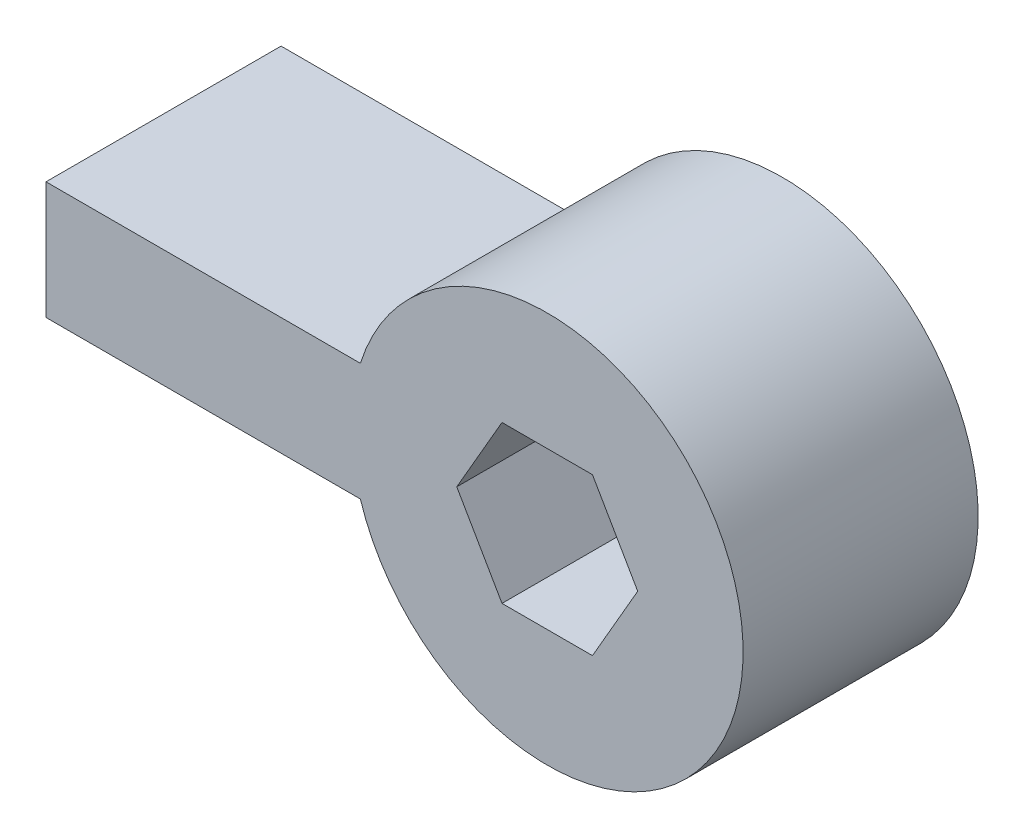
from build123d import *

# Parameters (mm, degrees)
SKETCH1_R                = 5
BOSS_EXTRUDE1_DEPTH      = 6
BOSS_EXTRUDE2_DEPTH      = 1.5
BOSS_EXTRUDE2_DEPTH_BACK = 1.5


with BuildPart() as part:
    # Sketch1 → Boss-Extrude1 (new body)
    with BuildSketch(Plane.XY):
        with Locations((5.549376682, 2)):
            Circle(SKETCH1_R)
        Polygon((4.394676144, 0), (6.704077221, 0), (7.858777759, 2), (6.704077221, 4), (4.394676144, 4), (3.239975606, 2), align=None, mode=Mode.SUBTRACT)
    extrude(amount=BOSS_EXTRUDE1_DEPTH)

    # Sketch2 → Boss-Extrude2 (add, two sides: drawn at the far end of the back side and taken through both)
    with BuildSketch(Plane(origin=(0, 2, 0), x_dir=(1, 0, 0), z_dir=(0, 1, 0)).offset(-BOSS_EXTRUDE2_DEPTH_BACK)):
        Polygon((3.239975606, 0), (0.549376682, 0), (-7.245305078, 0), (-7.245305078, -6), (0.549376682, -6), (3.239975606, -6), align=None)
    extrude(amount=BOSS_EXTRUDE2_DEPTH + BOSS_EXTRUDE2_DEPTH_BACK)


solid = part.part
